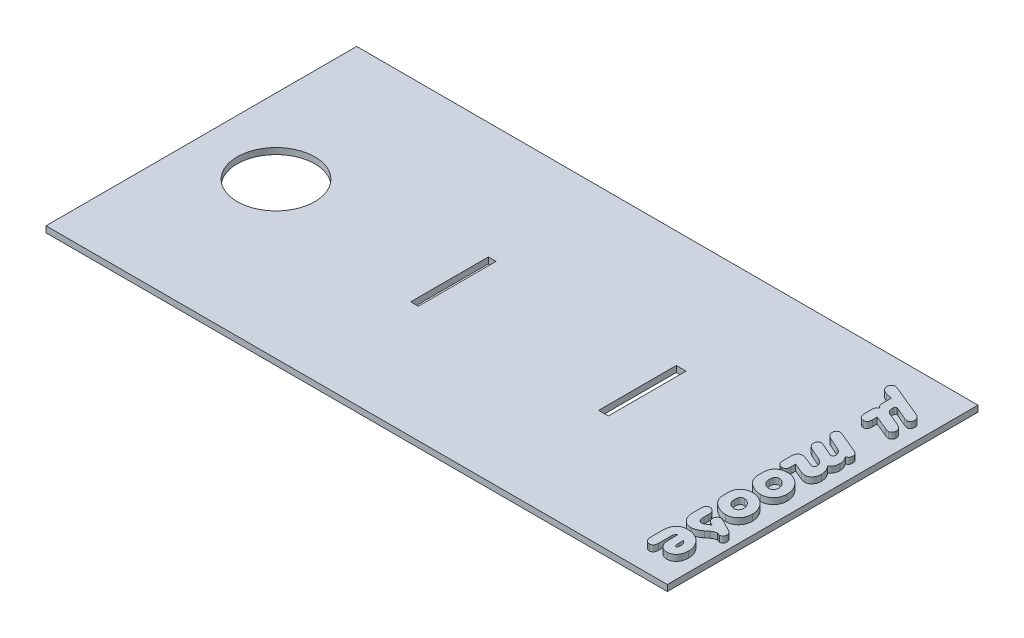
from build123d import *

# Parameters (mm, degrees)
SKETCH2_W           = 203.2
SKETCH2_H           = 101.6
BOSS_EXTRUDE1_DEPTH = 2
HOLE1_OUTLINE_R     = 12.7
HOLE1_DEPTH         = 2
SKETCH8_W           = 2.5
SKETCH8_H           = 25.4
CUT_EXTRUDE1_DEPTH  = 114.609858727
SKETCH9_W           = 3.175
SKETCH9_H           = 25.4
CUT_EXTRUDE2_DEPTH  = 114.609858727
BOSS_EXTRUDE2_DEPTH = 2


# Read off the part's stored shape, not the designer's step: Hole1
with BuildPart() as part:
    # Sketch2 → Boss-Extrude1 (new body)
    with BuildSketch(Plane(origin=(0, 0, 0), x_dir=(1, 0, 0), z_dir=(0, 1, 0))):
        Rectangle(SKETCH2_W, SKETCH2_H)
    extrude(amount=BOSS_EXTRUDE1_DEPTH)

    # Hole1 outline → Hole1 (cut)
    with BuildSketch(Plane(origin=(0, 0, 0), x_dir=(1, 0, 0), z_dir=(0, 1, 0))):
        with Locations((-77.172056655, 0)):
            Circle(HOLE1_OUTLINE_R)
    extrude(amount=HOLE1_DEPTH, mode=Mode.SUBTRACT)

    # Sketch8 → Cut-Extrude1 (cut, through all)
    with BuildSketch(Plane(origin=(0, 2, 0), x_dir=(1, 0, 0), z_dir=(0, 1, 0))):
        with Locations((-19.18597653, 0)):
            Rectangle(SKETCH8_W, SKETCH8_H)
    extrude(amount=-CUT_EXTRUDE1_DEPTH, mode=Mode.SUBTRACT)

    # Sketch9 → Cut-Extrude2 (cut, through all)
    with BuildSketch(Plane(origin=(0, 2, 0), x_dir=(1, 0, 0), z_dir=(0, 1, 0))):
        with Locations((42.624451749, 0)):
            Rectangle(SKETCH9_W, SKETCH9_H)
    extrude(amount=-CUT_EXTRUDE2_DEPTH, mode=Mode.SUBTRACT)

    # Sketch13 → Boss-Extrude2 (add)
    # profile 1 of 6: a face of its own
    with BuildSketch(Plane(origin=(0, 2, 0), x_dir=(1, 0, 0), z_dir=(0, 1, 0))):
        with BuildLine():
            Line((87.445736024, 36.583332561), (85.284654172, 37.117665986))
            add(Edge.make_bspline(
                [(85.284654172, 37.117665986), (85.154123444, 37.159200993), (84.896972182, 37.24102678), (84.535850684, 37.420289104), (84.212864412, 37.654481697), (83.925866508, 37.926403708), (83.692980956, 38.234634183), (83.518243574, 38.560485877), (83.414400685, 38.907116198), (83.39999517, 39.14350234), (83.392718045, 39.262915737)],
                knots=[0, 0, 0, 0, 1.071378435, 2.11066253, 3.139630895, 4.184238911, 5.194373523, 6.150693387, 7.065799788, 8, 8, 8, 8], degree=3))
            add(Edge.make_bspline(
                [(83.392718045, 39.262915737), (83.397227259, 39.354410977), (83.40598481, 39.532108046), (83.476414881, 39.788892014), (83.592259386, 40.026127262), (83.755616107, 40.236100212), (83.943130915, 40.418423832), (84.160342968, 40.547802223), (84.394387193, 40.633574829), (84.559577513, 40.640665999), (84.643454062, 40.644266591)],
                knots=[0, 0, 0, 0, 1.061841714, 2.062251086, 3.07015076, 4.109621275, 5.140007321, 6.089178041, 7.029766684, 8, 8, 8, 8], degree=3))
            add(Edge.make_bspline(
                [(84.643454062, 40.644266591), (84.721611958, 40.638401285), (84.898551791, 40.625122957), (85.188977631, 40.549492089), (85.537455403, 40.440058313), (85.784100657, 40.338950568), (85.917938231, 40.284086282)],
                knots=[0, 0, 0, 0, 0.705651676, 1.597508337, 2.696331457, 4, 4, 4, 4], degree=3))
            Line((85.917938231, 40.284086282), (95.749673252, 36.231068303))
            add(Edge.make_bspline(
                [(95.749673252, 36.231068303), (95.893520278, 36.169244044), (96.168855544, 36.050907231), (96.543294873, 35.83612861), (96.86216365, 35.603885048), (97.12391336, 35.353614201), (97.327382737, 35.084013991), (97.471758631, 34.794480463), (97.563783891, 34.485861954), (97.573424306, 34.272478034), (97.578280973, 34.164979059)],
                knots=[0, 0, 0, 0, 1.277959287, 2.446121197, 3.517264557, 4.492692359, 5.393546896, 6.260977325, 7.123911701, 8, 8, 8, 8], degree=3))
            add(Edge.make_bspline(
                [(97.578280973, 34.164979059), (97.575586867, 34.072079955), (97.570350638, 33.891522517), (97.497358331, 33.634191033), (97.39257338, 33.394929332), (97.236520985, 33.189158903), (97.056880432, 33.013401903), (96.850551433, 32.88199266), (96.620566777, 32.80403872), (96.460055638, 32.795736689), (96.378999286, 32.791544256)],
                knots=[0, 0, 0, 0, 1.095839172, 2.129858132, 3.143033799, 4.170547571, 5.164529347, 6.104680555, 7.042884607, 8, 8, 8, 8], degree=3))
            add(Edge.make_bspline(
                [(96.378999286, 32.791544256), (96.303428303, 32.795737599), (96.132718542, 32.805210078), (95.856183919, 32.882714799), (95.526308654, 32.987683863), (95.293825854, 33.08380465), (95.167843522, 33.135892463)],
                knots=[0, 0, 0, 0, 0.715723511, 1.616771209, 2.708529327, 4, 4, 4, 4], degree=3))
            Line((95.167843522, 33.135892463), (91.926220744, 34.525159368))
            Line((91.926220744, 34.525159368), (91.546250308, 34.687438408))
            add(Edge.make_bspline(
                [(91.546250308, 34.687438408), (91.453483305, 34.721359423), (91.292453894, 34.780241146), (91.12323231, 34.806796215), (91.051497137, 34.818053246)],
                knots=[0, 0, 0, 0, 1.152174663, 2, 2, 2, 2], degree=3))
            add(Edge.make_bspline(
                [(91.051497137, 34.818053246), (91.006495089, 34.817282707), (90.921743915, 34.815831571), (90.801812021, 34.785092117), (90.70332882, 34.722058239), (90.622624134, 34.636139031), (90.557200103, 34.526004653), (90.516531179, 34.387573307), (90.488072726, 34.225526274), (90.486391698, 34.108401212), (90.485499509, 34.046238298)],
                knots=[0, 0, 0, 0, 0.982938642, 1.851142485, 2.667938617, 3.504880713, 4.410645701, 5.441964331, 6.642349071, 8, 8, 8, 8], degree=3))
            add(Edge.make_bspline(
                [(90.485499509, 34.046238298), (90.48896595, 33.912757505), (90.495593893, 33.657538036), (90.554978478, 33.291124955), (90.657583463, 32.960542683), (90.800617747, 32.663491398), (90.984785182, 32.402089711), (91.210096811, 32.178090545), (91.475195325, 31.987041897), (91.676302941, 31.896248084), (91.779773805, 31.849534218)],
                knots=[0, 0, 0, 0, 1.175279339, 2.24717101, 3.258034877, 4.214450545, 5.139930643, 6.060361632, 7.002046458, 8, 8, 8, 8], degree=3))
            Line((91.779773805, 31.849534218), (95.765505353, 30.187163562))
            add(Edge.make_bspline(
                [(95.765505353, 30.187163562), (95.908084801, 30.124036652), (96.181099577, 30.00315963), (96.551561639, 29.784314862), (96.868195035, 29.546992289), (97.127905301, 29.289520351), (97.332510058, 29.01319617), (97.470875951, 28.713605077), (97.564077558, 28.398422304), (97.573521961, 28.179788861), (97.578280973, 28.069619989)],
                knots=[0, 0, 0, 0, 1.260384687, 2.413416859, 3.472063922, 4.45304343, 5.362390767, 6.235968166, 7.11110855, 8, 8, 8, 8], degree=3))
            add(Edge.make_bspline(
                [(97.578280973, 28.069619989), (97.573603603, 27.979494138), (97.56445516, 27.803217501), (97.495642652, 27.548328983), (97.377915154, 27.315727195), (97.221151688, 27.107718949), (97.033044111, 26.934858586), (96.823821943, 26.803189087), (96.591621053, 26.723987509), (96.429736659, 26.716055035), (96.347335083, 26.712017287)],
                knots=[0, 0, 0, 0, 1.06390721, 2.080890043, 3.091523785, 4.126381979, 5.141212972, 6.092800509, 7.029206955, 8, 8, 8, 8], degree=3))
            add(Edge.make_bspline(
                [(96.347335083, 26.712017287), (96.279884038, 26.714285002), (96.138626693, 26.719034097), (95.920960505, 26.761269514), (95.690016827, 26.830035598), (95.534220587, 26.890304035), (95.452821349, 26.921792631)],
                knots=[0, 0, 0, 0, 0.874952407, 1.832343069, 2.867459047, 4, 4, 4, 4], degree=3))
            Line((95.452821349, 26.921792631), (95.100557091, 27.06823957))
            Line((95.100557091, 27.06823957), (90.485499509, 28.956217672))
            Line((90.485499509, 28.956217672), (90.485499509, 27.408629752))
            add(Edge.make_bspline(
                [(90.485499509, 27.408629752), (90.483839611, 27.265871192), (90.480750429, 27.000187782), (90.424265969, 26.635150754), (90.343387959, 26.331112364), (90.214997079, 26.090146843), (90.039689134, 25.910489084), (89.819818998, 25.78406036), (89.553498548, 25.709293111), (89.360609455, 25.702407437), (89.258511644, 25.698762792)],
                knots=[0, 0, 0, 0, 1.410525523, 2.625084123, 3.645188451, 4.509743869, 5.294244881, 6.095609572, 6.991990207, 8, 8, 8, 8], degree=3))
            add(Edge.make_bspline(
                [(89.258511644, 25.698762792), (89.123193144, 25.70636698), (88.863427739, 25.720964431), (88.49481983, 25.832911575), (88.178941804, 26.030692356), (87.909381983, 26.295593277), (87.698058132, 26.631945071), (87.549593407, 27.027724595), (87.463059974, 27.481467821), (87.451730503, 27.801394546), (87.445736024, 27.970669354)],
                knots=[0, 0, 0, 0, 0.988693225, 1.897954043, 2.781467996, 3.68873083, 4.638734519, 5.661706955, 6.76279761, 8, 8, 8, 8], degree=3))
            Line((87.445736024, 27.970669354), (87.445736024, 30.361316678))
            add(Edge.make_bspline(
                [(87.445736024, 30.361316678), (87.449161029, 30.45249711), (87.455698122, 30.626527535), (87.494614191, 30.877098835), (87.56385965, 31.10411088), (87.669821129, 31.303717966), (87.797070446, 31.48168907), (87.954711996, 31.63485105), (88.142681657, 31.762642619), (88.283711226, 31.825298051), (88.35608186, 31.857450268)],
                knots=[0, 0, 0, 0, 1.167255414, 2.227867885, 3.237364307, 4.189126662, 5.107954473, 6.027557993, 6.987823057, 8, 8, 8, 8], degree=3))
            add(Edge.make_bspline(
                [(88.35608186, 31.857450268), (88.283754818, 31.919579158), (88.142732037, 32.040717651), (87.953212226, 32.23928555), (87.79847289, 32.455038651), (87.672901114, 32.682079433), (87.565665809, 32.917155216), (87.495878485, 33.1668169), (87.456200944, 33.428836294), (87.449281634, 33.606759968), (87.445736024, 33.697932066)],
                knots=[0, 0, 0, 0, 1.074888274, 2.095809936, 3.086807958, 4.059318953, 5.018538645, 5.993322927, 6.971733483, 8, 8, 8, 8], degree=3))
            Line((87.445736024, 33.697932066), (87.445736024, 36.583332561))
        make_face()
    # profile 2 of 6: a face of its own
    with BuildSketch(Plane(origin=(0, 2, 0), x_dir=(1, 0, 0), z_dir=(0, 1, 0))):
        with BuildLine():
            Line((90.485499509, 2.294958776), (90.485499509, 0.703832577))
            add(Edge.make_bspline(
                [(90.485499509, 0.703832577), (90.482403218, 0.578188926), (90.476593748, 0.342447787), (90.416080828, 0.013546352), (90.324470871, -0.268217615), (90.189107147, -0.503273727), (90.004570466, -0.681160813), (89.785646904, -0.811388147), (89.526097743, -0.889021143), (89.340873243, -0.8956523), (89.242679543, -0.899167698)],
                knots=[0, 0, 0, 0, 1.301802838, 2.442530782, 3.455165106, 4.363391002, 5.224629323, 6.083581601, 6.984042528, 8, 8, 8, 8], degree=3))
            add(Edge.make_bspline(
                [(89.242679543, -0.899167698), (89.108663316, -0.893012426), (88.851725933, -0.881211471), (88.487435456, -0.771477762), (88.173180833, -0.584861458), (87.905101138, -0.330733474), (87.701868669, -0.007616425), (87.547369597, 0.367720901), (87.464246649, 0.800558036), (87.452099452, 1.105910379), (87.445736024, 1.265872179)],
                knots=[0, 0, 0, 0, 1.00950738, 1.935438652, 2.836963341, 3.745333418, 4.695252962, 5.695439108, 6.792733325, 8, 8, 8, 8], degree=3))
            Line((87.445736024, 1.265872179), (87.445736024, 3.977119558))
            add(Edge.make_bspline(
                [(87.445736024, 3.977119558), (87.450493165, 4.116141986), (87.459648527, 4.383697774), (87.54492684, 4.763065175), (87.678644567, 5.104756612), (87.873219205, 5.397237602), (88.111913628, 5.637986893), (88.388185837, 5.818317331), (88.706890252, 5.920069435), (88.929284622, 5.933385075), (89.044778274, 5.940300142)],
                knots=[0, 0, 0, 0, 1.17413546, 2.259683869, 3.270775266, 4.261028724, 5.207771921, 6.12084617, 7.02411945, 8, 8, 8, 8], degree=3))
            add(Edge.make_bspline(
                [(89.044778274, 5.940300142), (89.133410439, 5.935750124), (89.328121361, 5.925754451), (89.63922194, 5.861305693), (89.994478137, 5.760792986), (90.241963359, 5.671526409), (90.374674799, 5.623658112)],
                knots=[0, 0, 0, 0, 0.774627493, 1.701734749, 2.767578575, 4, 4, 4, 4], degree=3))
            Line((90.374674799, 5.623658112), (93.256117268, 4.515411009))
            add(Edge.make_bspline(
                [(93.256117268, 4.515411009), (93.335814004, 4.487735888), (93.486085247, 4.435553389), (93.644708996, 4.425255008), (93.719206237, 4.4204184)],
                knots=[0, 0, 0, 0, 1.060705078, 2, 2, 2, 2], degree=3))
            add(Edge.make_bspline(
                [(93.719206237, 4.4204184), (93.784200965, 4.421559315), (93.906676821, 4.423709252), (94.075416489, 4.469396429), (94.219940226, 4.536608403), (94.337996592, 4.634886823), (94.430429422, 4.759698207), (94.494226546, 4.913043241), (94.533613115, 5.091286591), (94.536827675, 5.2197146), (94.538517488, 5.287225956)],
                knots=[0, 0, 0, 0, 1.137834258, 2.144131219, 3.045979375, 3.918459232, 4.813130763, 5.747454036, 6.815893575, 8, 8, 8, 8], degree=3))
            add(Edge.make_bspline(
                [(94.538517488, 5.287225956), (94.531462008, 5.398902653), (94.517037707, 5.627215727), (94.401484982, 5.963218234), (94.224242498, 6.298266586), (93.972957873, 6.620562337), (93.671008514, 6.930707297), (93.319506222, 7.215424692), (92.917137117, 7.460347349), (92.625634539, 7.593743057), (92.47638627, 7.662041178)],
                knots=[0, 0, 0, 0, 0.807370929, 1.650598053, 2.548383613, 3.544225015, 4.598516135, 5.679117783, 6.811716671, 8, 8, 8, 8], degree=3))
            Line((92.47638627, 7.662041178), (89.088316553, 9.130468591))
            add(Edge.make_bspline(
                [(89.088316553, 9.130468591), (88.959088519, 9.191357948), (88.710252627, 9.308603851), (88.371281865, 9.516935249), (88.086521883, 9.752127824), (87.85566859, 10.008232569), (87.666021824, 10.278936823), (87.540927488, 10.578968599), (87.456812847, 10.896409292), (87.449454081, 11.116845468), (87.445736024, 11.228222037)],
                knots=[0, 0, 0, 0, 1.208428076, 2.326896644, 3.35765651, 4.322054173, 5.238731909, 6.13894104, 7.059689905, 8, 8, 8, 8], degree=3))
            add(Edge.make_bspline(
                [(87.445736024, 11.228222037), (87.448771161, 11.315784793), (87.454653773, 11.485496365), (87.522822006, 11.728770467), (87.624518019, 11.952533144), (87.76827506, 12.150287151), (87.939005613, 12.315699715), (88.131800156, 12.43670023), (88.34120431, 12.514037762), (88.487347068, 12.522259955), (88.561899179, 12.526454359)],
                knots=[0, 0, 0, 0, 1.104361791, 2.140441715, 3.170593435, 4.198580968, 5.213486472, 6.157919137, 7.060295438, 8, 8, 8, 8], degree=3))
            add(Edge.make_bspline(
                [(88.561899179, 12.526454359), (88.624033004, 12.523857893), (88.754491368, 12.518406264), (88.956664222, 12.481586174), (89.172793511, 12.41546224), (89.319566401, 12.358579463), (89.397042532, 12.32855309)],
                knots=[0, 0, 0, 0, 0.863457339, 1.812945384, 2.845532504, 4, 4, 4, 4], degree=3))
            Line((89.397042532, 12.32855309), (89.729516663, 12.186064177))
            Line((89.729516663, 12.186064177), (93.153208609, 10.697846637))
            add(Edge.make_bspline(
                [(93.153208609, 10.697846637), (93.22389067, 10.667199083), (93.355532618, 10.610119484), (93.54645783, 10.554297028), (93.710378532, 10.507140072), (93.813934467, 10.502216263), (93.86169515, 10.499945369)],
                knots=[0, 0, 0, 0, 1.247760459, 2.323894018, 3.226968811, 4, 4, 4, 4], degree=3))
            add(Edge.make_bspline(
                [(93.86169515, 10.499945369), (93.905731334, 10.502803055), (93.995523592, 10.508630038), (94.121535751, 10.562917956), (94.238287269, 10.647229955), (94.378154636, 10.800018489), (94.510007054, 11.048282567), (94.528912241, 11.269957569), (94.538517488, 11.382585026)],
                knots=[0, 0, 0, 0, 0.645232645, 1.315665693, 1.983565079, 2.752668988, 4.350113312, 6, 6, 6, 6], degree=3))
            add(Edge.make_bspline(
                [(94.538517488, 11.382585026), (94.532002217, 11.499222911), (94.519155765, 11.729203052), (94.429026543, 12.065505065), (94.277003263, 12.38066086), (94.06076728, 12.673829583), (93.787405199, 12.94768311), (93.456819355, 13.206983771), (93.061093738, 13.437821431), (92.773075015, 13.572410567), (92.622833209, 13.642617513)],
                knots=[0, 0, 0, 0, 0.888822976, 1.752532061, 2.634326399, 3.541737762, 4.516194379, 5.576620865, 6.735870875, 8, 8, 8, 8], degree=3))
            Line((92.622833209, 13.642617513), (89.104148655, 15.186247408))
            add(Edge.make_bspline(
                [(89.104148655, 15.186247408), (88.973617576, 15.248507583), (88.723750932, 15.367687943), (88.382598787, 15.577658024), (88.094954787, 15.811941711), (87.859085887, 16.066550377), (87.671447952, 16.339873505), (87.539114969, 16.635866707), (87.462923468, 16.954338359), (87.45153485, 17.172776914), (87.445736024, 17.284000854)],
                knots=[0, 0, 0, 0, 1.219896637, 2.335164017, 3.371561227, 4.340710324, 5.254764422, 6.156874048, 7.061522223, 8, 8, 8, 8], degree=3))
            add(Edge.make_bspline(
                [(87.445736024, 17.284000854), (87.448507177, 17.371639571), (87.453929551, 17.543124137), (87.52733281, 17.788517701), (87.631988274, 18.017615749), (87.78465057, 18.217899489), (87.96328584, 18.388785625), (88.168707539, 18.512928965), (88.392376168, 18.594420764), (88.549317586, 18.60208233), (88.62918561, 18.605981328)],
                knots=[0, 0, 0, 0, 1.064722819, 2.083366093, 3.097936814, 4.12101588, 5.133927449, 6.093984171, 7.030022025, 8, 8, 8, 8], degree=3))
            add(Edge.make_bspline(
                [(88.62918561, 18.605981328), (88.770396104, 18.59646494), (89.075705063, 18.575889708), (89.361937916, 18.466744035), (89.515783293, 18.408080059)],
                knots=[0, 0, 0, 0, 0.925033413, 2, 2, 2, 2], degree=3))
            Line((89.515783293, 18.408080059), (89.864089526, 18.261633121))
            Line((89.864089526, 18.261633121), (96.240468398, 15.613714148))
            add(Edge.make_bspline(
                [(96.240468398, 15.613714148), (96.345742745, 15.565656624), (96.548021367, 15.473316848), (96.82251541, 15.307273466), (97.056241906, 15.123544113), (97.249129304, 14.92298849), (97.393846785, 14.698316447), (97.502535889, 14.460550078), (97.568282925, 14.20285838), (97.574911826, 14.02560212), (97.578280973, 13.93551139)],
                knots=[0, 0, 0, 0, 1.21295186, 2.330617466, 3.354881465, 4.323920194, 5.233443353, 6.143808079, 7.056587987, 8, 8, 8, 8], degree=3))
            add(Edge.make_bspline(
                [(97.578280973, 13.93551139), (97.57605045, 13.842849409), (97.571804647, 13.666467233), (97.51769564, 13.415892702), (97.435716459, 13.192068254), (97.319813871, 12.99299622), (97.166103849, 12.825088331), (96.980093825, 12.683890256), (96.759762034, 12.572524931), (96.597614222, 12.52393342), (96.513572148, 12.498748181)],
                knots=[0, 0, 0, 0, 1.138276205, 2.166709906, 3.137669574, 4.062044646, 4.981559819, 5.919942444, 6.921895113, 8, 8, 8, 8], degree=3))
            add(Edge.make_bspline(
                [(96.513572148, 12.498748181), (96.613676792, 12.35440505), (96.800576438, 12.084910261), (97.045577637, 11.695756007), (97.232997589, 11.348365565), (97.37295007, 11.030175467), (97.466240839, 10.714631997), (97.533539753, 10.381067133), (97.573099358, 10.014060169), (97.576503923, 9.758575019), (97.578280973, 9.625221762)],
                knots=[0, 0, 0, 0, 1.34683985, 2.514607512, 3.523860021, 4.371340138, 5.174617228, 6.041616506, 6.9778004, 8, 8, 8, 8], degree=3))
            add(Edge.make_bspline(
                [(97.578280973, 9.625221762), (97.574862908, 9.48120169), (97.568179624, 9.199601731), (97.505069002, 8.791199653), (97.395788477, 8.412759341), (97.254628354, 8.057649429), (97.063265827, 7.733639394), (96.830706671, 7.436675469), (96.556078168, 7.169162776), (96.346751932, 7.018286598), (96.240468398, 6.941680561)],
                knots=[0, 0, 0, 0, 1.102715071, 2.156119733, 3.154214426, 4.11508432, 5.075316256, 6.02549761, 6.997463977, 8, 8, 8, 8], degree=3))
            add(Edge.make_bspline(
                [(96.240468398, 6.941680561), (96.346767334, 6.818011409), (96.556180619, 6.574378084), (96.830146117, 6.185449915), (97.059921303, 5.783117036), (97.253739501, 5.371856855), (97.393412994, 4.943764476), (97.502935949, 4.5080217), (97.567853474, 4.058236227), (97.574785263, 3.754354883), (97.578280973, 3.601107148)],
                knots=[0, 0, 0, 0, 1.061913811, 2.092013972, 3.093019646, 4.077469406, 5.047748245, 6.0212193, 7.002098456, 8, 8, 8, 8], degree=3))
            add(Edge.make_bspline(
                [(97.578280973, 3.601107148), (97.570401449, 3.397234063), (97.555131432, 3.002140979), (97.423373156, 2.435220232), (97.196606868, 1.922858093), (96.89205229, 1.470902635), (96.521887661, 1.099162673), (96.106989325, 0.817675649), (95.641302515, 0.653019679), (95.316858322, 0.631598125), (95.152011421, 0.620714044)],
                knots=[0, 0, 0, 0, 1.144794364, 2.218538733, 3.247706536, 4.278048945, 5.263748443, 6.178902913, 7.074718494, 8, 8, 8, 8], degree=3))
            add(Edge.make_bspline(
                [(95.152011421, 0.620714044), (95.043657484, 0.625270674), (94.824496901, 0.634487078), (94.49234758, 0.68689457), (94.156475834, 0.779096739), (93.934950893, 0.86297011), (93.822114896, 0.905691871)],
                knots=[0, 0, 0, 0, 0.950733259, 1.922987396, 2.942052361, 4, 4, 4, 4], degree=3))
            Line((93.822114896, 0.905691871), (90.485499509, 2.294958776))
        make_face()
    # profile 3 of 6: a face of its own
    with BuildSketch(Plane(origin=(0, 2, 0), x_dir=(1, 0, 0), z_dir=(0, 1, 0))):
        with BuildLine():
            add(Edge.make_bspline(
                [(97.578280973, -7.5921886), (97.574230582, -7.750658178), (97.566273298, -8.061983031), (97.511123156, -8.518037416), (97.415935279, -8.951170006), (97.283434194, -9.362737044), (97.119032433, -9.755543509), (96.911978278, -10.126059037), (96.663536679, -10.471223059), (96.385242136, -10.794559394), (96.076154386, -11.085584301), (95.748682253, -11.347463326), (95.392762349, -11.558001018), (95.023504059, -11.742004712), (94.629266686, -11.872552428), (94.218181412, -11.974138483), (93.785605229, -12.03393958), (93.489821368, -12.041246924), (93.339235801, -12.044967142)],
                knots=[0, 0, 0, 0, 1.104234213, 2.169347313, 3.195495354, 4.18989073, 5.178617076, 6.15823925, 7.140446638, 8.137685636, 9.126198227, 10.095454196, 11.052555316, 12.002431256, 12.964816862, 13.939291404, 14.950879297, 16, 16, 16, 16], degree=3))
            add(Edge.make_bspline(
                [(93.339235801, -12.044967142), (93.106389831, -12.038118158), (92.638561011, -12.024357336), (91.942985696, -11.887384551), (91.247106054, -11.687978411), (90.570273394, -11.399019178), (89.924723153, -11.052924089), (89.340931495, -10.646243831), (88.817978784, -10.197421961), (88.527291857, -9.852368847), (88.383788037, -9.682025996)],
                knots=[0, 0, 0, 0, 0.98537627, 1.979795557, 2.993323283, 4.048062363, 5.091064544, 6.091185968, 7.05767312, 8, 8, 8, 8], degree=3))
            add(Edge.make_bspline(
                [(88.383788037, -9.682025996), (88.299994941, -9.565955191), (88.135903876, -9.338655057), (87.927819128, -8.980664673), (87.766198631, -8.614856937), (87.636800422, -8.2342577), (87.550766356, -7.810061397), (87.490406191, -7.324523134), (87.450231748, -6.764297662), (87.447295249, -6.366596799), (87.445736024, -6.15542539)],
                knots=[0, 0, 0, 0, 0.921254077, 1.804081356, 2.659560611, 3.492177375, 4.386734262, 5.440228603, 6.640811263, 8, 8, 8, 8], degree=3))
            add(Edge.make_bspline(
                [(87.445736024, -6.15542539), (87.447098693, -5.979922559), (87.449702465, -5.644573629), (87.473488332, -5.163967165), (87.511937563, -4.728033778), (87.566585684, -4.335529354), (87.635737738, -3.987126744), (87.72293788, -3.684022123), (87.82226147, -3.422932967), (87.910840746, -3.273014446), (87.952363272, -3.202738464)],
                knots=[0, 0, 0, 0, 1.39041541, 2.656790854, 3.811370106, 4.856520238, 5.795436321, 6.622484863, 7.354274382, 8, 8, 8, 8], degree=3))
            add(Edge.make_bspline(
                [(87.952363272, -3.202738464), (88.05439933, -3.060056344), (88.255872399, -2.778326478), (88.614267517, -2.410969044), (89.006141584, -2.097872319), (89.432618386, -1.841342442), (89.898994295, -1.647675571), (90.39792754, -1.50466667), (90.933895364, -1.420804663), (91.301875129, -1.410887533), (91.490837953, -1.405794946)],
                knots=[0, 0, 0, 0, 1.01381936, 2.001814882, 2.958005164, 3.909827514, 4.87115431, 5.871548072, 6.907009771, 8, 8, 8, 8], degree=3))
            add(Edge.make_bspline(
                [(91.490837953, -1.405794946), (91.693033752, -1.410663835), (92.094066014, -1.42032072), (92.683872537, -1.511211219), (93.253862324, -1.651665744), (93.801156209, -1.857101607), (94.327722431, -2.118272063), (94.833048514, -2.438197868), (95.318689127, -2.812354561), (95.776171718, -3.239993339), (96.195459717, -3.706532316), (96.566960305, -4.197347906), (96.875893404, -4.712625328), (97.137167385, -5.244247987), (97.336453491, -5.801977968), (97.470983936, -6.381436973), (97.564557197, -6.979640733), (97.573661493, -7.386002426), (97.578280973, -7.5921886)],
                knots=[0, 0, 0, 0, 1.007969748, 1.999192811, 2.969661913, 3.931726587, 4.908867187, 5.896676154, 6.910259227, 7.96262659, 9.015816757, 10.035895518, 11.027992098, 12.008142151, 12.986500924, 13.974572933, 14.972307028, 16, 16, 16, 16], degree=3))
        make_face()
        with BuildLine():
            add(Edge.make_bspline(
                [(94.538517488, -7.283462621), (94.529259841, -7.106692128), (94.510844095, -6.755052007), (94.340380014, -6.24388097), (94.071915417, -5.758349966), (93.700904438, -5.321461142), (93.285012505, -4.934603459), (92.819665635, -4.656103821), (92.332073332, -4.477353075), (91.994961745, -4.45612036), (91.82727011, -4.44555843)],
                knots=[0, 0, 0, 0, 0.983102837, 1.955634071, 2.973147209, 4.060146602, 5.138472955, 6.125092773, 7.067352561, 8, 8, 8, 8], degree=3))
            add(Edge.make_bspline(
                [(91.82727011, -4.44555843), (91.722175113, -4.449469524), (91.520700643, -4.456967365), (91.240879411, -4.553490997), (90.998446543, -4.700111536), (90.807738314, -4.917561688), (90.662080892, -5.188794617), (90.555184226, -5.516719958), (90.494424461, -5.902505822), (90.48859331, -6.178949361), (90.485499509, -6.325620481)],
                knots=[0, 0, 0, 0, 0.956805885, 1.834263912, 2.674438196, 3.520051675, 4.443416229, 5.473475652, 6.659515948, 8, 8, 8, 8], degree=3))
            add(Edge.make_bspline(
                [(90.485499509, -6.325620481), (90.491711758, -6.499124081), (90.503502002, -6.828417002), (90.608079438, -7.289955899), (90.773696413, -7.695267959), (90.947221169, -7.913434351), (91.03170701, -8.01965534)],
                knots=[0, 0, 0, 0, 1.142903159, 2.169118812, 3.108579422, 4, 4, 4, 4], degree=3))
            add(Edge.make_bspline(
                [(91.03170701, -8.01965534), (91.105470775, -8.097672492), (91.250663557, -8.251237422), (91.488073121, -8.450918982), (91.73040793, -8.624110094), (91.981322522, -8.763411283), (92.241146142, -8.872743619), (92.510409588, -8.945250279), (92.785817851, -8.996676631), (92.972219937, -9.002346895), (93.066132051, -9.005203657)],
                knots=[0, 0, 0, 0, 1.104697038, 2.174428561, 3.188273473, 4.167300995, 5.123441968, 6.082569835, 7.033970464, 8, 8, 8, 8], degree=3))
            add(Edge.make_bspline(
                [(93.066132051, -9.005203657), (93.170892413, -8.998703016), (93.374980244, -8.986038858), (93.667191301, -8.899238657), (93.921679728, -8.742348985), (94.141841984, -8.533904021), (94.319500954, -8.276191253), (94.446325429, -7.975779154), (94.528226936, -7.641380852), (94.535013221, -7.405345422), (94.538517488, -7.283462621)],
                knots=[0, 0, 0, 0, 0.989186373, 1.927073339, 2.843620029, 3.786540339, 4.77140281, 5.7757694, 6.851462863, 8, 8, 8, 8], degree=3))
        make_face(mode=Mode.SUBTRACT)
    # profile 4 of 6: a face of its own
    with BuildSketch(Plane(origin=(0, 2, 0), x_dir=(1, 0, 0), z_dir=(0, 1, 0))):
        with BuildLine():
            add(Edge.make_bspline(
                [(97.578280973, -18.991301667), (97.574230582, -19.149771245), (97.566273298, -19.461096098), (97.511123156, -19.917150483), (97.415935279, -20.350283073), (97.283434194, -20.761850111), (97.119032433, -21.154656577), (96.911978278, -21.525172104), (96.663536679, -21.870336126), (96.385242136, -22.193672462), (96.076154386, -22.484697368), (95.748682253, -22.746576393), (95.392762349, -22.957114085), (95.023504059, -23.141117779), (94.629266686, -23.271665495), (94.218181412, -23.37325155), (93.785605229, -23.433052647), (93.489821368, -23.440359991), (93.339235801, -23.444080209)],
                knots=[0, 0, 0, 0, 1.104234213, 2.169347313, 3.195495354, 4.18989073, 5.178617076, 6.15823925, 7.140446638, 8.137685636, 9.126198227, 10.095454196, 11.052555316, 12.002431256, 12.964816862, 13.939291404, 14.950879297, 16, 16, 16, 16], degree=3))
            add(Edge.make_bspline(
                [(93.339235801, -23.444080209), (93.106389831, -23.437231225), (92.638561011, -23.423470404), (91.942985696, -23.286497619), (91.247106054, -23.087091479), (90.570273394, -22.798132245), (89.924723153, -22.452037156), (89.340931495, -22.045356898), (88.817978784, -21.596535029), (88.527291857, -21.251481914), (88.383788037, -21.081139063)],
                knots=[0, 0, 0, 0, 0.98537627, 1.979795557, 2.993323283, 4.048062363, 5.091064544, 6.091185968, 7.05767312, 8, 8, 8, 8], degree=3))
            add(Edge.make_bspline(
                [(88.383788037, -21.081139063), (88.299994941, -20.965068258), (88.135903876, -20.737768124), (87.927819128, -20.37977774), (87.766198631, -20.013970004), (87.636800422, -19.633370767), (87.550766356, -19.209174464), (87.490406191, -18.723636201), (87.450231748, -18.163410729), (87.447295249, -17.765709867), (87.445736024, -17.554538458)],
                knots=[0, 0, 0, 0, 0.921254077, 1.804081356, 2.659560611, 3.492177375, 4.386734262, 5.440228603, 6.640811263, 8, 8, 8, 8], degree=3))
            add(Edge.make_bspline(
                [(87.445736024, -17.554538458), (87.447098693, -17.379035626), (87.449702465, -17.043686697), (87.473488332, -16.563080232), (87.511937563, -16.127146845), (87.566585684, -15.734642421), (87.635737738, -15.386239812), (87.72293788, -15.08313519), (87.82226147, -14.822046035), (87.910840746, -14.672127514), (87.952363272, -14.601851531)],
                knots=[0, 0, 0, 0, 1.39041541, 2.656790854, 3.811370106, 4.856520238, 5.795436321, 6.622484863, 7.354274382, 8, 8, 8, 8], degree=3))
            add(Edge.make_bspline(
                [(87.952363272, -14.601851531), (88.05439933, -14.459169411), (88.255872399, -14.177439545), (88.614267517, -13.810082111), (89.006141584, -13.496985387), (89.432618386, -13.240455509), (89.898994295, -13.046788638), (90.39792754, -12.903779737), (90.933895364, -12.819917731), (91.301875129, -12.8100006), (91.490837953, -12.804908013)],
                knots=[0, 0, 0, 0, 1.01381936, 2.001814882, 2.958005164, 3.909827514, 4.87115431, 5.871548072, 6.907009771, 8, 8, 8, 8], degree=3))
            add(Edge.make_bspline(
                [(91.490837953, -12.804908013), (91.693033752, -12.809776902), (92.094066014, -12.819433788), (92.683872537, -12.910324286), (93.253862324, -13.050778811), (93.801156209, -13.256214675), (94.327722431, -13.51738513), (94.833048514, -13.837310935), (95.318689127, -14.211467628), (95.776171718, -14.639106406), (96.195459717, -15.105645383), (96.566960305, -15.596460973), (96.875893404, -16.111738395), (97.137167385, -16.643361054), (97.336453491, -17.201091035), (97.470983936, -17.78055004), (97.564557197, -18.3787538), (97.573661493, -18.785115494), (97.578280973, -18.991301667)],
                knots=[0, 0, 0, 0, 1.007969748, 1.999192811, 2.969661913, 3.931726587, 4.908867187, 5.896676154, 6.910259227, 7.96262659, 9.015816757, 10.035895518, 11.027992098, 12.008142151, 12.986500924, 13.974572933, 14.972307028, 16, 16, 16, 16], degree=3))
        make_face()
        with BuildLine():
            add(Edge.make_bspline(
                [(94.538517488, -18.682575688), (94.529259841, -18.505805195), (94.510844095, -18.154165075), (94.340380014, -17.642994037), (94.071915417, -17.157463033), (93.700904438, -16.720574209), (93.285012505, -16.333716526), (92.819665635, -16.055216888), (92.332073332, -15.876466143), (91.994961745, -15.855233427), (91.82727011, -15.844671498)],
                knots=[0, 0, 0, 0, 0.983102837, 1.955634071, 2.973147209, 4.060146602, 5.138472955, 6.125092773, 7.067352561, 8, 8, 8, 8], degree=3))
            add(Edge.make_bspline(
                [(91.82727011, -15.844671498), (91.722175113, -15.848582592), (91.520700643, -15.856080433), (91.240879411, -15.952604065), (90.998446543, -16.099224603), (90.807738314, -16.316674756), (90.662080892, -16.587907685), (90.555184226, -16.915833025), (90.494424461, -17.30161889), (90.48859331, -17.578062429), (90.485499509, -17.724733549)],
                knots=[0, 0, 0, 0, 0.956805885, 1.834263912, 2.674438196, 3.520051675, 4.443416229, 5.473475652, 6.659515948, 8, 8, 8, 8], degree=3))
            add(Edge.make_bspline(
                [(90.485499509, -17.724733549), (90.491711758, -17.898237148), (90.503502002, -18.22753007), (90.608079438, -18.689068966), (90.773696413, -19.094381026), (90.947221169, -19.312547418), (91.03170701, -19.418768407)],
                knots=[0, 0, 0, 0, 1.142903159, 2.169118812, 3.108579422, 4, 4, 4, 4], degree=3))
            add(Edge.make_bspline(
                [(91.03170701, -19.418768407), (91.105470775, -19.496785559), (91.250663557, -19.650350489), (91.488073121, -19.850032049), (91.73040793, -20.023223161), (91.981322522, -20.16252435), (92.241146142, -20.271856686), (92.510409588, -20.344363347), (92.785817851, -20.395789698), (92.972219937, -20.401459962), (93.066132051, -20.404316724)],
                knots=[0, 0, 0, 0, 1.104697038, 2.174428561, 3.188273473, 4.167300995, 5.123441968, 6.082569835, 7.033970464, 8, 8, 8, 8], degree=3))
            add(Edge.make_bspline(
                [(93.066132051, -20.404316724), (93.170892413, -20.397816083), (93.374980244, -20.385151926), (93.667191301, -20.298351724), (93.921679728, -20.141462052), (94.141841984, -19.933017088), (94.319500954, -19.67530432), (94.446325429, -19.374892221), (94.528226936, -19.040493919), (94.535013221, -18.80445849), (94.538517488, -18.682575688)],
                knots=[0, 0, 0, 0, 0.989186373, 1.927073339, 2.843620029, 3.786540339, 4.77140281, 5.7757694, 6.851462863, 8, 8, 8, 8], degree=3))
        make_face(mode=Mode.SUBTRACT)
    # profile 5 of 6: a face of its own
    with BuildSketch(Plane(origin=(0, 2, 0), x_dir=(1, 0, 0), z_dir=(0, 1, 0))):
        with BuildLine():
            Line((94.039806292, -28.640967521), (93.473808664, -28.379737846))
            add(Edge.make_bspline(
                [(93.473808664, -28.379737846), (93.377477531, -28.329194884), (93.192228812, -28.231998695), (92.944904061, -28.055003107), (92.73221782, -27.866099207), (92.560091311, -27.657079529), (92.422754155, -27.434244693), (92.326854484, -27.193288817), (92.270471732, -26.936335621), (92.262672417, -26.759867283), (92.258694875, -26.669870886)],
                knots=[0, 0, 0, 0, 1.174117443, 2.257875999, 3.277186543, 4.239058904, 5.172954822, 6.09414408, 7.028039998, 8, 8, 8, 8], degree=3))
            add(Edge.make_bspline(
                [(92.258694875, -26.669870886), (92.263596548, -26.578481703), (92.27332161, -26.397162892), (92.340920758, -26.132967304), (92.460749056, -25.887457937), (92.614930961, -25.661240982), (92.802045995, -25.470713063), (93.005080553, -25.321322447), (93.22967304, -25.233486723), (93.384713162, -25.222665395), (93.461934588, -25.217275575)],
                knots=[0, 0, 0, 0, 1.057964689, 2.09903287, 3.13075787, 4.206980699, 5.254751105, 6.208318771, 7.107610487, 8, 8, 8, 8], degree=3))
            add(Edge.make_bspline(
                [(93.461934588, -25.217275575), (93.542782176, -25.222750172), (93.720241824, -25.234766859), (94.002162356, -25.312238692), (94.319049534, -25.436872987), (94.536755467, -25.54648392), (94.653300224, -25.605162061)],
                knots=[0, 0, 0, 0, 0.768147754, 1.686076628, 2.761284849, 4, 4, 4, 4], degree=3))
            Line((94.653300224, -25.605162061), (98.108656373, -27.382315453))
            add(Edge.make_bspline(
                [(98.108656373, -27.382315453), (98.207444096, -27.437139331), (98.395594777, -27.541556659), (98.648976614, -27.722218788), (98.862908322, -27.912819753), (99.045369532, -28.109180023), (99.181243022, -28.321914121), (99.277634838, -28.543773108), (99.340350383, -28.774762531), (99.347761523, -28.933470113), (99.351476339, -29.013021905)],
                knots=[0, 0, 0, 0, 1.254889241, 2.390056746, 3.44940031, 4.435704489, 5.358962696, 6.23882182, 7.117213696, 8, 8, 8, 8], degree=3))
            add(Edge.make_bspline(
                [(99.351476339, -29.013021905), (99.34818439, -29.097868366), (99.341757617, -29.26351159), (99.276244723, -29.502028461), (99.165921992, -29.719217533), (99.022224984, -29.91394864), (98.84970436, -30.078656088), (98.652158991, -30.19317426), (98.440217548, -30.271373678), (98.291431147, -30.279435206), (98.215523058, -30.283548049)],
                knots=[0, 0, 0, 0, 1.075916519, 2.100479871, 3.112352934, 4.154854301, 5.162833391, 6.117130863, 7.039394751, 8, 8, 8, 8], degree=3))
            add(Edge.make_bspline(
                [(98.215523058, -30.283548049), (98.190276749, -30.281825601), (98.126549173, -30.277477739), (98.017966837, -30.238117097), (97.86890285, -30.199667768), (97.76122965, -30.157011779), (97.70097976, -30.133143085)],
                knots=[0, 0, 0, 0, 0.562462146, 1.419785776, 2.556208742, 4, 4, 4, 4], degree=3))
            add(Edge.make_bspline(
                [(97.70097976, -30.133143085), (97.609503799, -30.102145707), (97.441010297, -30.045050304), (97.263580646, -30.034882211), (97.182478436, -30.030234426)],
                knots=[0, 0, 0, 0, 1.085809962, 2, 2, 2, 2], degree=3))
            add(Edge.make_bspline(
                [(97.182478436, -30.030234426), (97.041656329, -30.039063009), (96.754520767, -30.057064444), (96.325552096, -30.195727193), (95.891021701, -30.408627695), (95.621327756, -30.609895896), (95.480527527, -30.714972815)],
                knots=[0, 0, 0, 0, 0.903479948, 1.84219102, 2.873463769, 4, 4, 4, 4], degree=3))
            Line((95.480527527, -30.714972815), (94.435608829, -31.546158143))
            add(Edge.make_bspline(
                [(94.435608829, -31.546158143), (94.303545918, -31.646771907), (94.047156938, -31.842105028), (93.651633656, -32.100842808), (93.26218374, -32.324358023), (92.872123284, -32.502730911), (92.486035784, -32.643849432), (92.102802752, -32.741808517), (91.722510142, -32.805265482), (91.469970711, -32.81289191), (91.344391014, -32.816684287)],
                knots=[0, 0, 0, 0, 1.169686632, 2.270847738, 3.328397313, 4.331060642, 5.289870021, 6.221237339, 7.115478822, 8, 8, 8, 8], degree=3))
            add(Edge.make_bspline(
                [(91.344391014, -32.816684287), (91.208280539, -32.812985143), (90.940007921, -32.805694161), (90.547112242, -32.744983884), (90.171466797, -32.645767473), (89.813123398, -32.506121382), (89.471298625, -32.32792665), (89.148491908, -32.107303474), (88.842477304, -31.848341175), (88.556883774, -31.553572888), (88.294465474, -31.230646226), (88.071441594, -30.880359024), (87.873112381, -30.516403268), (87.721000611, -30.128278831), (87.595948226, -29.723914902), (87.512111505, -29.299281761), (87.451876367, -28.856417911), (87.447813499, -28.554108503), (87.445736024, -28.399527973)],
                knots=[0, 0, 0, 0, 0.993241798, 1.957671351, 2.894532395, 3.824635469, 4.759513946, 5.702543649, 6.673110019, 7.681185445, 8.695042061, 9.70491044, 10.708882264, 11.715852748, 12.742665798, 13.794825053, 14.872423076, 16, 16, 16, 16], degree=3))
            Line((87.445736024, -28.399527973), (87.445736024, -25.609120087))
            add(Edge.make_bspline(
                [(87.445736024, -25.609120087), (87.449562123, -25.479669068), (87.456747118, -25.236574157), (87.508338836, -24.895258951), (87.607596752, -24.606159368), (87.742159483, -24.365970326), (87.916854919, -24.17604998), (88.133745412, -24.041024005), (88.392291346, -23.966403838), (88.575932612, -23.956125062), (88.672723889, -23.950707456)],
                knots=[0, 0, 0, 0, 1.323532141, 2.485449164, 3.513452649, 4.431917301, 5.281225849, 6.123328076, 7.010867896, 8, 8, 8, 8], degree=3))
            add(Edge.make_bspline(
                [(88.672723889, -23.950707456), (88.808154265, -23.956516834), (89.068247229, -23.967673699), (89.434902766, -24.082177461), (89.753382203, -24.272757479), (90.016808979, -24.540771162), (90.225605535, -24.869565782), (90.384656703, -25.252717291), (90.466941809, -25.695407734), (90.479106448, -26.007264848), (90.485499509, -26.171159689)],
                knots=[0, 0, 0, 0, 1.001648299, 1.923657629, 2.8144713, 3.727511656, 4.682605041, 5.687162827, 6.784500768, 8, 8, 8, 8], degree=3))
            Line((90.485499509, -26.171159689), (90.485499509, -27.718747609))
            add(Edge.make_bspline(
                [(90.485499509, -27.718747609), (90.488232616, -27.879989811), (90.493343144, -28.181490214), (90.557704685, -28.602520971), (90.655838948, -28.961910691), (90.798952399, -29.258540118), (90.982480983, -29.495582193), (91.218723209, -29.657007752), (91.492851126, -29.762960653), (91.691639313, -29.772126859), (91.795605907, -29.776920802)],
                knots=[0, 0, 0, 0, 1.403090559, 2.623583424, 3.70007281, 4.635380244, 5.477058889, 6.277238603, 7.098992566, 8, 8, 8, 8], degree=3))
            add(Edge.make_bspline(
                [(91.795605907, -29.776920802), (91.879244436, -29.770662473), (92.057674238, -29.757311301), (92.331660409, -29.670958514), (92.627600988, -29.540062211), (92.820901824, -29.418188941), (92.923643137, -29.353412087)],
                knots=[0, 0, 0, 0, 0.822745714, 1.755200092, 2.806866562, 4, 4, 4, 4], degree=3))
            Line((92.923643137, -29.353412087), (94.039806292, -28.640967521))
        make_face()
    # profile 6 of 6: a face of its own
    with BuildSketch(Plane(origin=(0, 2, 0), x_dir=(1, 0, 0), z_dir=(0, 1, 0))):
        with BuildLine():
            add(Edge.make_bspline(
                [(91.24544038, -37.024065255), (91.185260019, -37.028204505), (91.068140115, -37.036260097), (90.905749455, -37.112957881), (90.772616055, -37.237492441), (90.663144827, -37.407122461), (90.583190884, -37.624718536), (90.526079855, -37.887055976), (90.490883506, -38.196029168), (90.487381432, -38.417186677), (90.485499509, -38.536030947)],
                knots=[0, 0, 0, 0, 0.764218114, 1.487281743, 2.238032404, 3.064425828, 4.039761261, 5.179114726, 6.484129918, 8, 8, 8, 8], degree=3))
            Line((90.485499509, -38.536030947), (90.485499509, -42.501972368))
            add(Edge.make_bspline(
                [(90.485499509, -42.501972368), (90.482341103, -42.635504966), (90.476394543, -42.88691653), (90.416300725, -43.238116449), (90.325019653, -43.539419122), (90.19053538, -43.790530064), (90.006297003, -43.981205336), (89.787127836, -44.120495497), (89.526476269, -44.201687433), (89.340904523, -44.210913764), (89.242679543, -44.215797354)],
                knots=[0, 0, 0, 0, 1.329951266, 2.503996275, 3.539647919, 4.458105728, 5.313878097, 6.153119145, 7.022427504, 8, 8, 8, 8], degree=3))
            add(Edge.make_bspline(
                [(89.242679543, -44.215797354), (89.108634047, -44.208268045), (88.851364094, -44.193817244), (88.486001022, -44.080549771), (88.171468998, -43.884946511), (87.903763661, -43.618109834), (87.699937225, -43.278084265), (87.547828889, -42.880789417), (87.463751768, -42.422294444), (87.451951992, -42.098584738), (87.445736024, -41.92805869)],
                knots=[0, 0, 0, 0, 0.978365959, 1.877751762, 2.76060975, 3.660357094, 4.612685084, 5.634898014, 6.75409514, 8, 8, 8, 8], degree=3))
            Line((87.445736024, -41.92805869), (87.445736024, -38.148144461))
            add(Edge.make_bspline(
                [(87.445736024, -38.148144461), (87.448512365, -37.976504197), (87.453884287, -37.644398683), (87.502736154, -37.161614613), (87.57956976, -36.711140831), (87.691611203, -36.291483707), (87.831773926, -35.903166534), (88.008712913, -35.54713915), (88.212817669, -35.221202621), (88.453108768, -34.929433861), (88.723955139, -34.671837583), (89.022176006, -34.443191792), (89.352843548, -34.25332748), (89.712194055, -34.099516283), (90.098696067, -33.975117219), (90.515408578, -33.890075888), (90.961732181, -33.837302101), (91.269032169, -33.832444098), (91.427509547, -33.829938781)],
                knots=[0, 0, 0, 0, 1.227348773, 2.374788334, 3.466999781, 4.492476289, 5.477694438, 6.414590758, 7.330872307, 8.222576002, 9.110276068, 9.999229205, 10.904019189, 11.829631798, 12.790598928, 13.802965857, 14.866969655, 16, 16, 16, 16], degree=3))
            add(Edge.make_bspline(
                [(91.427509547, -33.829938781), (91.633608231, -33.835094091), (92.039610236, -33.845249741), (92.637617934, -33.93086293), (93.213413493, -34.070619754), (93.771007067, -34.2587461), (94.303482264, -34.510564111), (94.811660586, -34.818633825), (95.302854929, -35.176051148), (95.762318363, -35.588650514), (96.187294028, -36.03390662), (96.559137358, -36.508197683), (96.870982676, -37.003994085), (97.134371262, -37.518487888), (97.329619399, -38.058063767), (97.473485508, -38.617129909), (97.563806065, -39.196720167), (97.573418324, -39.591177144), (97.578280973, -39.790724989)],
                knots=[0, 0, 0, 0, 1.04050648, 2.049735156, 3.043648261, 4.029803133, 5.01643062, 6.011749843, 7.02729366, 8.079764279, 9.126121427, 10.132464478, 11.117763567, 12.080268604, 13.045767299, 14.008964006, 14.992774966, 16, 16, 16, 16], degree=3))
            add(Edge.make_bspline(
                [(97.578280973, -39.790724989), (97.574563772, -39.934588815), (97.567285923, -40.216257534), (97.530299307, -40.628409718), (97.456590784, -41.016578639), (97.364120372, -41.384816286), (97.235590164, -41.729828842), (97.082371036, -42.055362509), (96.898415542, -42.358488542), (96.689558652, -42.637446132), (96.461613416, -42.892119576), (96.210701513, -43.111892866), (95.939368304, -43.294087722), (95.652800795, -43.445279272), (95.349675111, -43.566629895), (95.026064347, -43.647607348), (94.685463317, -43.701628176), (94.451657555, -43.706626847), (94.332700169, -43.709170106)],
                knots=[0, 0, 0, 0, 1.207589965, 2.364321374, 3.467463956, 4.520116344, 5.546413606, 6.55171456, 7.535259715, 8.51618424, 9.472431444, 10.398330367, 11.307260942, 12.208607936, 13.113212821, 14.039641131, 15.002594442, 16, 16, 16, 16], degree=3))
            add(Edge.make_bspline(
                [(94.332700169, -43.709170106), (94.191215482, -43.704806898), (93.914288286, -43.696266813), (93.513660034, -43.623892934), (93.141037245, -43.506300737), (92.800857735, -43.33539285), (92.48300563, -43.125714075), (92.199246221, -42.861346027), (91.939898919, -42.552841547), (91.800288688, -42.318175166), (91.728319475, -42.197204415)],
                knots=[0, 0, 0, 0, 1.06934193, 2.093017052, 3.068074139, 4.01410823, 4.963346821, 5.937944301, 6.937008248, 8, 8, 8, 8], degree=3))
            add(Edge.make_bspline(
                [(91.728319475, -42.197204415), (91.688090276, -42.124224116), (91.604854929, -41.973225824), (91.514860747, -41.720756765), (91.428913365, -41.44699382), (91.365228714, -41.145693132), (91.306529374, -40.820229873), (91.275371678, -40.467970009), (91.249072176, -40.09060925), (91.246678612, -39.830362548), (91.24544038, -39.695732381)],
                knots=[0, 0, 0, 0, 0.775768942, 1.605087792, 2.492325041, 3.450334938, 4.473645932, 5.574054255, 6.745015868, 8, 8, 8, 8], degree=3))
            Line((91.24544038, -39.695732381), (91.24544038, -37.024065255))
        make_face()
        with BuildLine():
            Line((93.778576617, -37.665265365), (93.778576617, -39.137650803))
            add(Edge.make_bspline(
                [(93.778576617, -39.137650803), (93.779689595, -39.260413985), (93.78176244, -39.489052014), (93.806818328, -39.807278827), (93.838469166, -40.075265909), (93.888731818, -40.293693118), (93.954453852, -40.463644109), (94.033915556, -40.587847466), (94.13882617, -40.664040847), (94.215552595, -40.66762976), (94.253539662, -40.669406622)],
                knots=[0, 0, 0, 0, 1.705094431, 3.175621766, 4.432939085, 5.451044315, 6.281582412, 6.952824954, 7.481546181, 8, 8, 8, 8], degree=3))
            add(Edge.make_bspline(
                [(94.253539662, -40.669406622), (94.296227414, -40.663586992), (94.379391094, -40.65224927), (94.495430938, -40.599753059), (94.586842084, -40.511747255), (94.664284746, -40.401873056), (94.72239954, -40.26414351), (94.765993176, -40.100518093), (94.787675909, -39.90871669), (94.790387801, -39.772295748), (94.791831112, -39.699690406)],
                knots=[0, 0, 0, 0, 0.838547182, 1.633645842, 2.4358048, 3.286135424, 4.243266486, 5.336598247, 6.582496278, 8, 8, 8, 8], degree=3))
            add(Edge.make_bspline(
                [(94.791831112, -39.699690406), (94.788928099, -39.595273827), (94.783237576, -39.39059518), (94.734449624, -39.091754319), (94.655426245, -38.808662262), (94.544616548, -38.542339695), (94.401364928, -38.294340514), (94.222665422, -38.067181508), (94.018835035, -37.851113066), (93.859533454, -37.727888111), (93.778576617, -37.665265365)],
                knots=[0, 0, 0, 0, 1.058976454, 2.075818501, 3.063330973, 4.035478358, 4.995287288, 5.959288559, 6.962913359, 8, 8, 8, 8], degree=3))
        make_face(mode=Mode.SUBTRACT)
    extrude(amount=BOSS_EXTRUDE2_DEPTH)


solid = part.part
